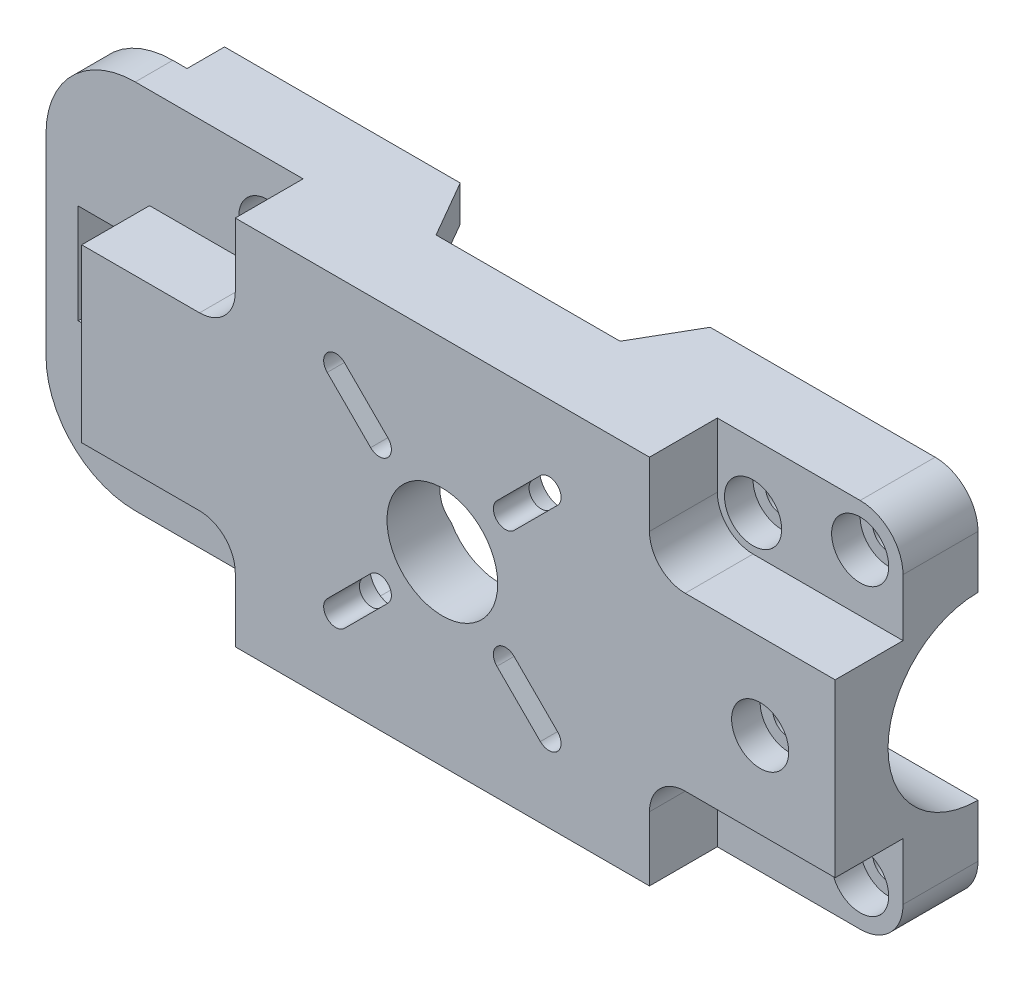
from build123d import *

# Parameters (mm, degrees)
BOSS_EXTRUDE2_DEPTH             = 20
CUT_EXTRUDE1_START              = -9.5
CUT_EXTRUDE1_DEPTH              = 9.5
CBORE_FOR_M4_SHCS1_D            = 4.5
CBORE_FOR_M4_SHCS1_CBORE_D      = 8
CBORE_FOR_M4_SHCS1_CBORE_DEPTH  = 4
CUT_EXTRUDE2_DEPTH              = 12
CUT_EXTRUDE3_DEPTH              = 69.381283989
CUT_EXTRUDE3_DEPTH_BACK         = 69.381283989
CBORE_START                     = 12
CBORE_SLOT_FOR_M3_SHCS1_DEPTH   = 8
CBORE_SLOT_FOR_M3_SHCS1_2_DEPTH = 3
CUT_EXTRUDE4_DEPTH              = 10
CUT_EXTRUDE4_DEPTH_BACK         = 111.48189897
M14_CLEARANCE_HOLE1_D           = 15.5
CBORE_FOR_M4_SHCS2_D            = 4.5
CBORE_FOR_M4_SHCS2_CBORE_D      = 8
CBORE_FOR_M4_SHCS2_CBORE_DEPTH  = 4
BOSS_EXTRUDE3_REACH             = 70.381
SKETCH16_W                      = 17
SKETCH16_H                      = 5.63508794
CUT_EXTRUDE5_DEPTH              = 69.381284106
CUT_EXTRUDE5_DEPTH_BACK         = 69.381284106
SKETCH18_W                      = 14.5
SKETCH18_H                      = 5.25


# Read off the part's stored shape, not the designer's step: CBORE SLOT for M3 SHCS1
with BuildPart() as part:
    # Sketch2 → Boss-Extrude2 (new body)
    with BuildSketch(Plane.XY):
        with BuildLine():
            Line((54, 26), (-47.5, 26))
            ThreePointArc((-47.5, 26), (-56.338834765, 22.338834765), (-60, 13.5))
            Line((-60, 13.5), (-60, -13.5))
            ThreePointArc((-60, -13.5), (-56.338834765, -22.338834765), (-47.5, -26))
            Line((-47.5, -26), (54, -26))
            ThreePointArc((54, -26), (58.242640687, -24.242640687), (60, -20))
            Line((60, -20), (60, 20))
            ThreePointArc((60, 20), (58.242640687, 24.242640687), (54, 26))
        make_face()
    extrude(amount=BOSS_EXTRUDE2_DEPTH)

    # Sketch3 → Cut-Extrude1 (cut)
    with BuildSketch(Plane.XY.offset(20).offset(CUT_EXTRUDE1_START)):
        with BuildLine():
            Line((-47.5, -26), (-24, -26))
            Line((-24, -26), (-24, -17))
            ThreePointArc((-24, -17), (-25.464466094, -13.464466094), (-29, -12))
            Line((-29, -12), (-45.5, -12))
            Line((-45.5, -12), (-45.5, 12))
            Line((-45.5, 12), (-29, 12))
            ThreePointArc((-29, 12), (-25.464466094, 13.464466094), (-24, 17))
            Line((-24, 17), (-24, 26))
            Line((-24, 26), (-47.5, 26))
            ThreePointArc((-47.5, 26), (-56.338834765, 22.338834765), (-60, 13.5))
            Line((-60, 13.5), (-60, -13.5))
            ThreePointArc((-60, -13.5), (-56.338834765, -22.338834765), (-47.5, -26))
        make_face()
        with BuildLine():
            Line((39, 12), (60, 12))
            Line((60, 12), (60, 20))
            ThreePointArc((60, 20), (58.242640687, 24.242640687), (54, 26))
            Line((54, 26), (34, 26))
            Line((34, 26), (34, 17))
            ThreePointArc((34, 17), (35.464466094, 13.464466094), (39, 12))
        make_face()
        with BuildLine():
            Line((60, -20), (60, -12))
            Line((60, -12), (39, -12))
            ThreePointArc((39, -12), (35.464466094, -13.464466094), (34, -17))
            Line((34, -17), (34, -26))
            Line((34, -26), (54, -26))
            ThreePointArc((54, -26), (58.242640687, -24.242640687), (60, -20))
        make_face()
    extrude(amount=CUT_EXTRUDE1_DEPTH, mode=Mode.SUBTRACT)

    # CBORE for M4 SHCS1 (through all)
    with Locations(Plane.XY.offset(10.5)):
        with Locations((39, -17), (39, 17), (-29, 17), (-29, -17), (54, 20), (54, -20)):
            CounterBoreHole(CBORE_FOR_M4_SHCS1_D / 2, CBORE_FOR_M4_SHCS1_CBORE_D / 2, CBORE_FOR_M4_SHCS1_CBORE_DEPTH)

    # Sketch6 → Cut-Extrude2 (cut)
    with BuildSketch(Plane.XY):
        with BuildLine():
            Line((25, -21), (-15, -21))
            ThreePointArc((-15, -21), (-18.535533906, -19.535533906), (-20, -16))
            Line((-20, -16), (-20, 16))
            ThreePointArc((-20, 16), (-18.535533906, 19.535533906), (-15, 21))
            Line((-15, 21), (25, 21))
            ThreePointArc((25, 21), (28.535533906, 19.535533906), (30, 16))
            Line((30, 16), (30, -16))
            ThreePointArc((30, -16), (28.535533906, -19.535533906), (25, -21))
        make_face()
    extrude(amount=CUT_EXTRUDE2_DEPTH, mode=Mode.SUBTRACT)

    # Sketch7 → Cut-Extrude3 (cut, two sides: drawn at the far end of the back side and taken through both)
    with BuildSketch(Plane(origin=(0, 0, 0), x_dir=(1, 0, 0), z_dir=(0, 1, 0)).offset(-CUT_EXTRUDE3_DEPTH_BACK)):
        Polygon((-12.5, 0), (22.5, 0), (17.881197846, -8), (-7.881197846, -8), align=None)
    extrude(amount=CUT_EXTRUDE3_DEPTH + CUT_EXTRUDE3_DEPTH_BACK, mode=Mode.SUBTRACT)

    # CBORE SLOT for M3 SHCS1 outline → CBORE SLOT for M3 SHCS1 (cut)
    with BuildSketch(Plane.XY.offset(CBORE_START)):
        with BuildLine():
            ThreePointArc((-8.717871555, 16.122034611), (-11.122034611, 16.122034611), (-11.122034611, 13.717871555))
            Line((-11.122034611, 13.717871555), (-5.040916293, 7.636753237))
            ThreePointArc((-5.040916293, 7.636753237), (-2.636753237, 7.636753237), (-2.636753237, 10.040916293))
            Line((-2.636753237, 10.040916293), (-8.717871555, 16.122034611))
        make_face()
        with BuildLine():
            ThreePointArc((18.717871555, -16.122034611), (21.122034611, -16.122034611), (21.122034611, -13.717871555))
            Line((21.122034611, -13.717871555), (15.040916293, -7.636753237))
            ThreePointArc((15.040916293, -7.636753237), (12.636753237, -7.636753237), (12.636753237, -10.040916293))
            Line((12.636753237, -10.040916293), (18.717871555, -16.122034611))
        make_face()
    cbore_slot_for_m3_shcs1 = extrude(amount=CBORE_SLOT_FOR_M3_SHCS1_DEPTH, mode=Mode.SUBTRACT)

    # CBORE SLOT for M3 SHCS1 2 outline → CBORE SLOT for M3 SHCS1 2 (cut)
    # profile 1 of 2: a face of its own
    with BuildSketch(Plane.XY.offset(CBORE_START)):
        with BuildLine():
            ThreePointArc((-7.621856044, 17.218050122), (-12.218050122, 17.218050122), (-12.218050122, 12.621856044))
            Line((-12.218050122, 12.621856044), (-6.136931804, 6.540737726))
            ThreePointArc((-6.136931804, 6.540737726), (-1.540737726, 6.540737726), (-1.540737726, 11.136931804))
            Line((-1.540737726, 11.136931804), (-7.621856044, 17.218050122))
        make_face()
        with BuildLine():
            Line((-5.040916293, 7.636753237), (-11.122034611, 13.717871555))
            ThreePointArc((-11.122034611, 13.717871555), (-11.122034611, 16.122034611), (-8.717871555, 16.122034611))
            Line((-8.717871555, 16.122034611), (-2.636753237, 10.040916293))
            ThreePointArc((-2.636753237, 10.040916293), (-2.636753237, 7.636753237), (-5.040916293, 7.636753237))
        make_face(mode=Mode.SUBTRACT)
    # profile 2 of 2: a face of its own
    with BuildSketch(Plane.XY.offset(CBORE_START)):
        with BuildLine():
            ThreePointArc((17.621856044, -17.218050122), (22.218050122, -17.218050122), (22.218050122, -12.621856044))
            Line((22.218050122, -12.621856044), (16.136931804, -6.540737726))
            ThreePointArc((16.136931804, -6.540737726), (11.540737726, -6.540737726), (11.540737726, -11.136931804))
            Line((11.540737726, -11.136931804), (17.621856044, -17.218050122))
        make_face()
        with BuildLine():
            Line((15.040916293, -7.636753237), (21.122034611, -13.717871555))
            ThreePointArc((21.122034611, -13.717871555), (21.122034611, -16.122034611), (18.717871555, -16.122034611))
            Line((18.717871555, -16.122034611), (12.636753237, -10.040916293))
            ThreePointArc((12.636753237, -10.040916293), (12.636753237, -7.636753237), (15.040916293, -7.636753237))
        make_face(mode=Mode.SUBTRACT)
    cbore_slot_for_m3_shcs1_2 = extrude(amount=CBORE_SLOT_FOR_M3_SHCS1_2_DEPTH, mode=Mode.SUBTRACT)

    # Mirror1: CBORE SLOT for M3 SHCS1, CBORE SLOT for M3 SHCS1 2 across plane
    add(cbore_slot_for_m3_shcs1.mirror(Plane.ZX), mode=Mode.SUBTRACT)
    add(cbore_slot_for_m3_shcs1_2.mirror(Plane.ZX), mode=Mode.SUBTRACT)

    # Sketch10 → Cut-Extrude4 (cut, two sides: drawn at the far end of the back side and taken through both)
    with BuildSketch(Plane.ZY.offset(45.5).offset(-CUT_EXTRUDE4_DEPTH_BACK)):
        with BuildLine():
            Line((0, 12.6), (0, -12.6))
            ThreePointArc((0, -12.6), (12.6, 0), (0, 12.6))
        make_face()
    extrude(amount=CUT_EXTRUDE4_DEPTH + CUT_EXTRUDE4_DEPTH_BACK, mode=Mode.SUBTRACT)

    # M14 Clearance Hole1 (through all)
    with Locations(Plane.XY.offset(20)):
        with Locations((5, 0)):
            Hole(M14_CLEARANCE_HOLE1_D / 2)

    # CBORE for M4 SHCS2 (through all)
    with Locations(Plane.XY.offset(20)):
        with Locations((49.5, 0)):
            CounterBoreHole(CBORE_FOR_M4_SHCS2_D / 2, CBORE_FOR_M4_SHCS2_CBORE_D / 2, CBORE_FOR_M4_SHCS2_CBORE_DEPTH)

    # Sketch16 → Boss-Extrude3 (add, up to next)
    with BuildSketch(Plane(origin=(0, 0, 0), x_dir=(-1, 0, 0), z_dir=(0, 0, -1)), mode=Mode.PRIVATE) as boss_extrude3_sk1:
        with Locations((47, 9.78245603)):
            Rectangle(SKETCH16_W, SKETCH16_H)
    boss_extrude3_tool1 = extrude(boss_extrude3_sk1.sketch, amount=-BOSS_EXTRUDE3_REACH, mode=Mode.PRIVATE) - part.part
    # Sketch16 → Boss-Extrude3 (add, up to next)
    with BuildSketch(Plane(origin=(0, 0, 0), x_dir=(-1, 0, 0), z_dir=(0, 0, -1)), mode=Mode.PRIVATE) as boss_extrude3_sk2:
        with Locations((47, -9.78245603)):
            Rectangle(SKETCH16_W, SKETCH16_H)
    boss_extrude3_tool2 = extrude(boss_extrude3_sk2.sketch, amount=-BOSS_EXTRUDE3_REACH, mode=Mode.PRIVATE) - part.part
    add(boss_extrude3_tool1.solids().sort_by_distance((-47, 9.782456, 0))[0])
    add(boss_extrude3_tool2.solids().sort_by_distance((-47, -9.782456, 0))[0])

    # Sketch18 → Cut-Extrude5 (cut, two sides: drawn at the far end of the back side and taken through both)
    with BuildSketch(Plane(origin=(0, 0, 0), x_dir=(1, 0, 0), z_dir=(0, 1, 0)).offset(-CUT_EXTRUDE5_DEPTH_BACK)):
        with Locations((-52.75, -2.625)):
            Rectangle(SKETCH18_W, SKETCH18_H)
    extrude(amount=CUT_EXTRUDE5_DEPTH + CUT_EXTRUDE5_DEPTH_BACK, mode=Mode.SUBTRACT)


solid = part.part
